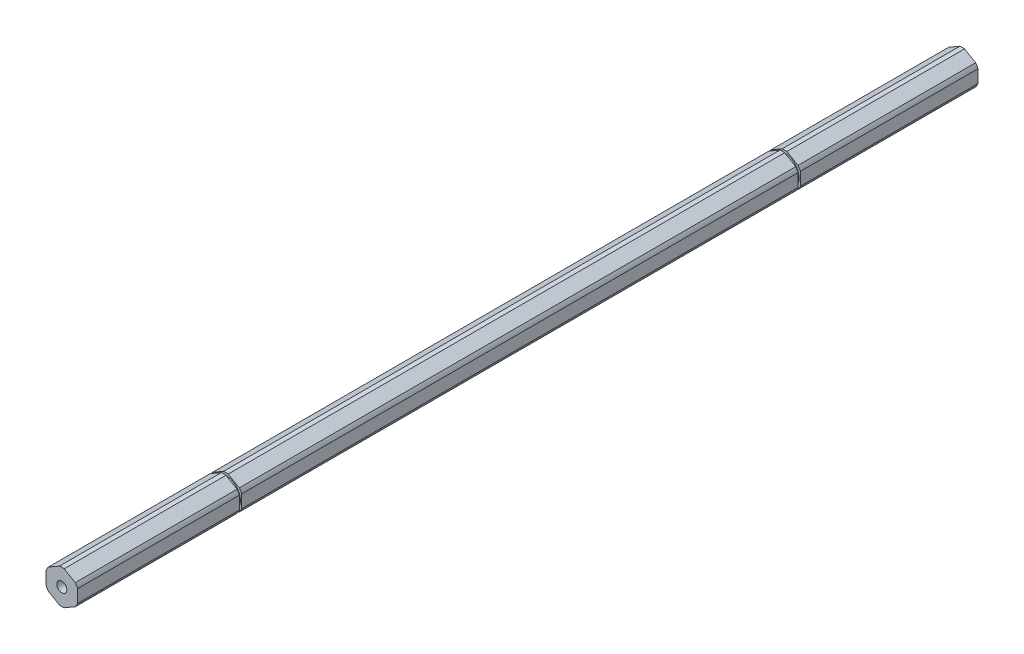
from build123d import *

# Parameters (mm, degrees)
BOSS_EXTRUDE1_DEPTH = 180.975
SKETCH2_R           = 2.0193
CUT_EXTRUDE1_DEPTH  = 363.070652172
SKETCH4_W           = 3.175
SKETCH4_H           = 0.889


with BuildPart() as part:
    # Sketch1 → Boss-Extrude1 (new, symmetric)
    with BuildSketch(Plane.XY):
        with BuildLine():
            ThreePointArc((0.93173274, 6.79441227), (0, 6.858), (-0.93173274, 6.79441227))
            Line((-0.93173274, 6.79441227), (-5.41826726, 4.204110358))
            ThreePointArc((-5.41826726, 4.204110358), (-5.939202219, 3.429), (-6.35, 2.590301913))
            Line((-6.35, 2.590301913), (-6.35, -2.590301913))
            ThreePointArc((-6.35, -2.590301913), (-5.939202219, -3.429), (-5.41826726, -4.204110358))
            Line((-5.41826726, -4.204110358), (-0.93173274, -6.79441227))
            ThreePointArc((-0.93173274, -6.79441227), (0, -6.858), (0.93173274, -6.79441227))
            Line((0.93173274, -6.79441227), (5.41826726, -4.204110358))
            ThreePointArc((5.41826726, -4.204110358), (5.939202219, -3.429), (6.35, -2.590301913))
            Line((6.35, -2.590301913), (6.35, 2.590301913))
            ThreePointArc((6.35, 2.590301913), (5.939202219, 3.429), (5.41826726, 4.204110358))
            Line((5.41826726, 4.204110358), (0.93173274, 6.79441227))
        make_face()
    extrude(amount=BOSS_EXTRUDE1_DEPTH, both=True)

    # Sketch2 → Cut-Extrude1 (cut, through all)
    with BuildSketch(Plane.XY.offset(180.975)):
        Circle(SKETCH2_R)
    extrude(amount=-CUT_EXTRUDE1_DEPTH, mode=Mode.SUBTRACT)

    # Sketch4 → Cut-Revolve4 (revolve, cut)
    with BuildSketch(Plane(origin=(0, 0, 0), x_dir=(1, 0, 0), z_dir=(0, 1, 0))):
        with Locations((7.4422, 109.1057)):
            Rectangle(SKETCH4_W, SKETCH4_H)
        with Locations((7.4422, -115.4557)):
            Rectangle(SKETCH4_W, SKETCH4_H)
    revolve(axis=Axis((0, 0, -180.975), (0, 0, 1)), mode=Mode.SUBTRACT)


solid = part.part
